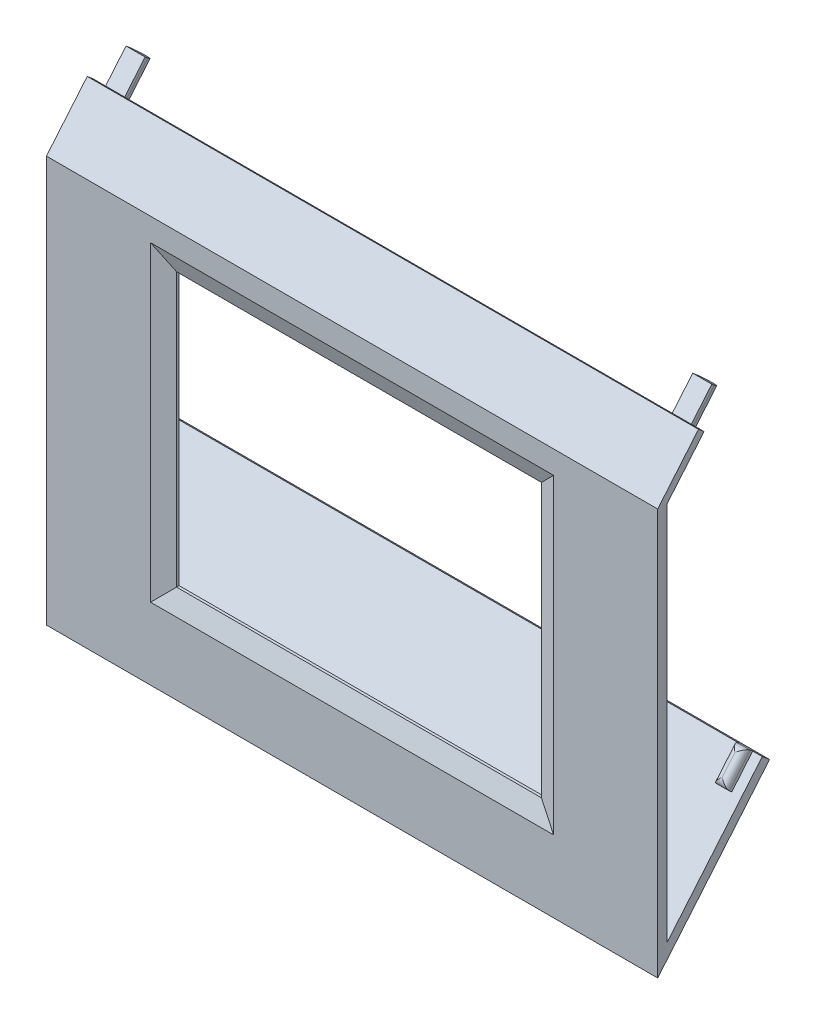
from build123d import *

# Parameters (mm, degrees)
SKETCH_1_W          = 60
SKETCH_1_H          = 45
EXTRUDE_1_DEPTH     = 1.5
EXTRUDE_2_DEPTH     = 96
SKETCH_4_W          = 60
SKETCH_4_H          = 2.1
EXTRUDE_3_DEPTH     = 1.5
EXTRUDE_4_DEPTH     = 1.5
CUT_EXTRUDE_2_DEPTH = 100
EXTRUDE_5_DEPTH     = 96
SKETCH_12_W         = 3
SKETCH_12_H         = 14
EXTRUDE_6_DEPTH     = 2
FILLET_1_R          = 1.5
SKETCH_13_W         = 2
SKETCH_13_H         = 5.103076436
EXTRUDE_7_DEPTH     = 1.5
FILLET_3_R          = 1
CHAMFER_3_SIZE      = 3
CHAMFER_3_SIZE2     = 1.091910703


with BuildPart() as part:
    # Эскиз1 → Бобышка-Вытянуть1 (new body)
    with BuildSketch(Plane.XY):
        Polygon((46, -35), (-46, -35), (-48, -35), (-48, -25), (-48, 25), (-48, 27), (-46, 27), (46, 27), (48, 27), (48, 25), (48, -25), (48, -35), align=None)
        Rectangle(SKETCH_1_W, SKETCH_1_H, mode=Mode.SUBTRACT)
    extrude(amount=EXTRUDE_1_DEPTH)

    # Эскиз2 → Бобышка-Вытянуть2 (add)
    with BuildSketch(Plane(origin=(48, 0, 0), x_dir=(0, 0, -1), z_dir=(1, 0, 0))):
        Polygon((8.78785553, 39.260588787), (9.668091663, 38.521982973), (0, 27), (-1.5, 27), align=None)
        Polygon((0, -32.66641426), (0, -35), (16.069690242, -15.848888922), (14.920623577, -14.884707507), align=None)
    extrude(amount=-EXTRUDE_2_DEPTH)

    # Эскиз4 → Бобышка-Вытянуть3 (add)
    with BuildSketch(Plane.XY.offset(1.5)):
        with Locations((0, 21.45)):
            Rectangle(SKETCH_4_W, SKETCH_4_H)
    extrude(amount=-EXTRUDE_3_DEPTH)

    # Эскиз6 → Бобышка-Вытянуть4 (add)
    with BuildSketch(Plane.XY.offset(1.5)):
        Polygon((-28.65, -20.7), (-28.65, 20.4), (-30, 20.4), (-30, -22.5), (-28.65, -22.5), align=None)
        Polygon((28.65, 20.4), (28.65, -20.7), (28.65, -22.5), (30, -22.5), (30, 20.4), align=None)
    extrude(amount=-EXTRUDE_4_DEPTH)

    # Эскиз8 → Вырез-Вытянуть2 (cut)
    with BuildSketch(Plane(origin=(48, 0, 0), x_dir=(0, 0, -1), z_dir=(1, 0, 0))):
        Polygon((5.785088487, 33.894399988), (4.904852354, 34.633005803), (8.78785553, 39.260588787), (9.668091663, 38.521982973), align=None)
    extrude(amount=-CUT_EXTRUDE_2_DEPTH, mode=Mode.SUBTRACT)

    # Эскиз9 → Бобышка-Вытянуть5 (add)
    with BuildSketch(Plane(origin=(48, 0, 0), x_dir=(0, 0, -1), z_dir=(1, 0, 0))):
        Polygon((-1.5, -35), (-1.5, -36.787630389), (0, -35), align=None)
    extrude(amount=-EXTRUDE_5_DEPTH)

    # Эскиз12 → Бобышка-Вытянуть6 (add)
    with BuildSketch(Plane(origin=(0, 11.155749601, 13.294904666), x_dir=(-1, 0, 0), z_dir=(0, -0.6427876096865351, -0.7660444431189816))):
        with Locations((44.5, 27.683199964)):
            Rectangle(SKETCH_12_W, SKETCH_12_H)
        with Locations((-44.5, 27.683199964)):
            Rectangle(SKETCH_12_W, SKETCH_12_H)
    extrude(amount=EXTRUDE_6_DEPTH)

    # Скругление1
    fillet_1_edges = [part.edges().sort_by_distance(p)[0] for p in [
        (-43, 31.076735882, -6.031602154),
        (-46, 31.076735882, -6.031602154),
        (-44.5, 25.714424781, -1.532088886),
        (46, 31.076735882, -6.031602154),
        (43, 31.076735882, -6.031602154),
        (44.5, 25.714424781, -1.532088886),
    ]]
    fillet(fillet_1_edges, radius=FILLET_1_R - 0.0001)  # a hair under: the kernel refuses the full size

    # Эскиз13 → Бобышка-Вытянуть7 (add)
    with BuildSketch(Plane(origin=(0, -13.496975476, -16.085069013), x_dir=(1, 0, 0), z_dir=(0, 0.642787609686538, 0.7660444431189792))):
        with Locations((-45.5, -4.363093727)):
            Rectangle(SKETCH_13_W, SKETCH_13_H)
        with Locations((45.5, -4.363093727)):
            Rectangle(SKETCH_13_W, SKETCH_13_H)
    extrude(amount=EXTRUDE_7_DEPTH)

    # Скругление3
    fillet_3_edges = [part.edges().sort_by_distance(p)[0] for p in [
        (-46.5, -15.875117766, -12.131459761),
        (-45.5, -17.82970944, -10.491362608),
        (-44.5, -15.875117766, -12.131459761),
        (-45.5, -13.920526093, -13.771556913),
        (45.5, -13.920526093, -13.771556913),
        (44.5, -15.875117766, -12.131459761),
        (45.5, -17.82970944, -10.491362608),
        (46.5, -15.875117766, -12.131459761),
    ]]
    fillet(fillet_3_edges, radius=FILLET_3_R - 0.0001)  # a hair under: the kernel refuses the full size

    # Фаска3
    chamfer_3_edges = [part.edges().sort_by_distance(p)[0] for p in [
        (28.65, -1.05, 1.5),
        (0, 20.4, 1.5),
        (0, -22.5, 1.5),
        (-28.65, -1.05, 1.5),
    ]]
    chamfer_3_side = [part.faces().sort_by_distance(p)[0] for p in [
        (-46.847400252, -4.893815194, 1.5),
    ]]
    chamfer(chamfer_3_edges, length=CHAMFER_3_SIZE, length2=CHAMFER_3_SIZE2, reference=chamfer_3_side[0])


solid = part.part
